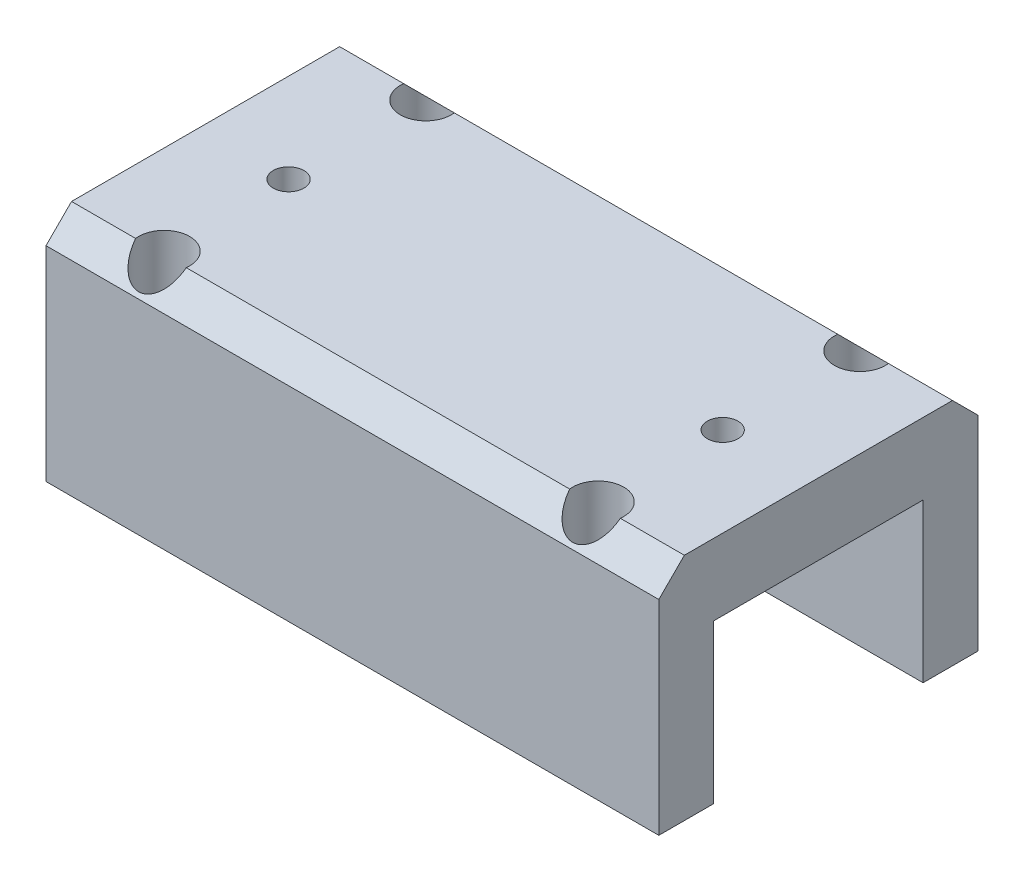
from build123d import *

# Parameters (mm, degrees)
SKETCH_1_W          = 24
SKETCH_1_H          = 12.5
EXTRUDE_1_DEPTH     = 9
SKETCH_2_W          = 24
SKETCH_2_H          = 8.2
CUT_EXTRUDE_1_DEPTH = 6.2
SKETCH_3_R          = 0.5
CUT_EXTRUDE_2_DEPTH = 17.25
SKETCH_4_R          = 0.6
CUT_EXTRUDE_3_DEPTH = 17.25
SKETCH_5_R          = 1
CUT_EXTRUDE_4_DEPTH = 7
CHAMFER_1_SIZE      = 1


with BuildPart() as part:
    # 草图1 → 凸台-拉伸1 (new body)
    with BuildSketch(Plane(origin=(0, 0, 0), x_dir=(1, 0, 0), z_dir=(0, 1, 0))):
        Rectangle(SKETCH_1_W, SKETCH_1_H)
    extrude(amount=EXTRUDE_1_DEPTH)

    # 草图2 → 切除-拉伸1 (cut)
    with BuildSketch(Plane.XZ):
        Rectangle(SKETCH_2_W, SKETCH_2_H)
    extrude(amount=-CUT_EXTRUDE_1_DEPTH, mode=Mode.SUBTRACT)

    # 草图3 → 切除-拉伸2 (cut, through all)
    with BuildSketch(Plane(origin=(0, 9, 0), x_dir=(1, 0, 0), z_dir=(0, 1, 0))):
        with Locations(Location((-8.5, 5.125, 0), (0, 0, 270))):
            Circle(SKETCH_3_R)
        with Locations(Location((8.5, 5.125, 0), (0, 0, 90))):
            Circle(SKETCH_3_R)
        with Locations(Location((8.5, -5.125, 0), (0, 0, 270))):
            Circle(SKETCH_3_R)
        with Locations(Location((-8.5, -5.125, 0), (0, 0, 90))):
            Circle(SKETCH_3_R)
    extrude(amount=-CUT_EXTRUDE_2_DEPTH, mode=Mode.SUBTRACT)

    # 草图4 → 切除-拉伸3 (cut, through all)
    with BuildSketch(Plane(origin=(0, 9, 0), x_dir=(1, 0, 0), z_dir=(0, 1, 0))):
        with Locations(Location((-8.5, -0.25, 0), (0, 0, 270))):
            Circle(SKETCH_4_R)
        with Locations(Location((8.5, -0.25, 0), (0, 0, 90))):
            Circle(SKETCH_4_R)
    extrude(amount=-CUT_EXTRUDE_3_DEPTH, mode=Mode.SUBTRACT)

    # 草图5 → 切除-拉伸4 (cut)
    with BuildSketch(Plane(origin=(0, 9, 0), x_dir=(1, 0, 0), z_dir=(0, 1, 0))):
        with Locations(Location((-8.5, 5.125, 0), (0, 0, 270))):
            Circle(SKETCH_5_R)
        with Locations(Location((8.5, 5.125, 0), (0, 0, 270))):
            Circle(SKETCH_5_R)
        with Locations(Location((-8.5, -5.125, 0), (0, 0, 270))):
            Circle(SKETCH_5_R)
        with Locations(Location((8.5, -5.125, 0), (0, 0, 270))):
            Circle(SKETCH_5_R)
    extrude(amount=-CUT_EXTRUDE_4_DEPTH, mode=Mode.SUBTRACT)

    # 倒角1
    # the kernel refuses this chamfer: 1 mm, written as the material it takes off along each edge
    with BuildSketch(Plane(origin=(-14.571682988, 9, -6.25), x_dir=(0, 0.027495876610585623, 0.9996219169112968), z_dir=(1, 0, 0))) as chamfer_1_piece_1:
        Polygon((CHAMFER_1_SIZE * 0.999621916911, CHAMFER_1_SIZE * 0.0274958766106), (-CHAMFER_1_SIZE * 0.0274958766106, CHAMFER_1_SIZE * 0.999621916911), (0, 0), align=None)
    extrude(amount=29.143365976, mode=Mode.SUBTRACT)
    with BuildSketch(Plane(origin=(14.571682988, 9, 6.25), x_dir=(0, -0.9996219169112968, 0.027495876610586487), z_dir=(-1, 0, 0))) as chamfer_1_piece_2:
        Polygon((CHAMFER_1_SIZE * 0.999621916911, -CHAMFER_1_SIZE * 0.0274958766106), (-CHAMFER_1_SIZE * 0.0274958766106, -CHAMFER_1_SIZE * 0.999621916911), (0, 0), align=None)
    extrude(amount=29.143365976, mode=Mode.SUBTRACT)


solid = part.part
